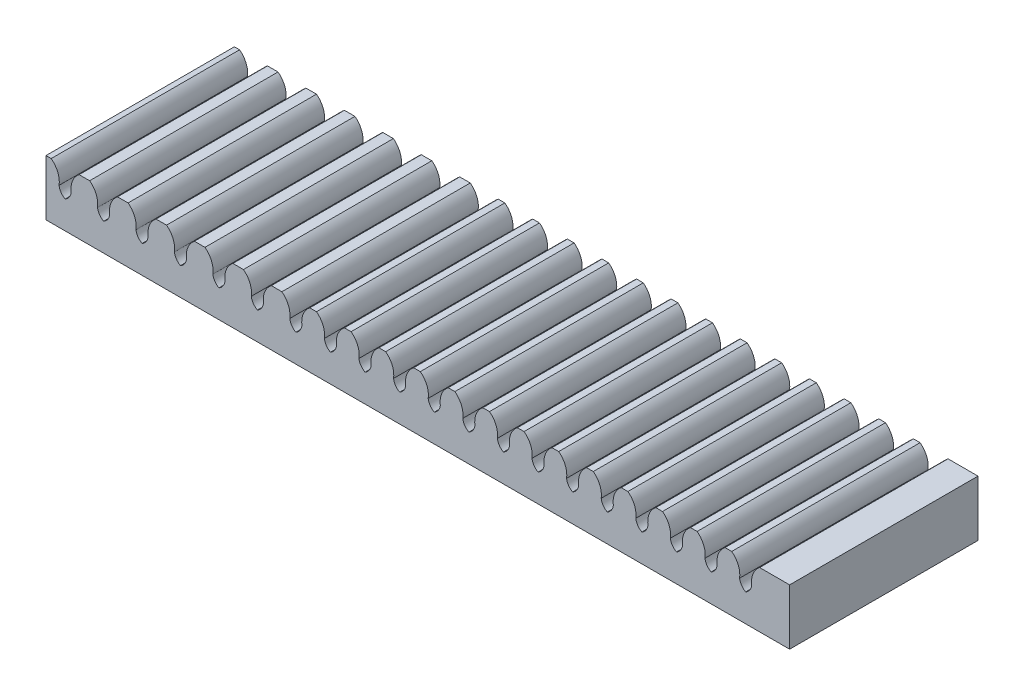
from build123d import *

# Parameters (mm, degrees)
BOSS_EXTRUDE1_DEPTH = 24.5
CUT_EXTRUDE1_DEPTH  = 26.12
LPATTERN1_COUNT     = 10
LPATTERN1_PITCH     = 5
LPATTERN1_COL_COUNT = 14
LPATTERN1_COL_PITCH = 4.5


with BuildPart() as part:
    # Sketch1 → Boss-Extrude1 (new body)
    with BuildSketch(Plane.XY):
        Polygon((28.000000003, 7), (-39.373173928, 7), (-39.373173928, -0.249149017), (0.939234275, -0.249149017), (57.333339072, -0.249149017), (57.333339072, 7), align=None)
    extrude(amount=BOSS_EXTRUDE1_DEPTH)

    # Sketch2 → Cut-Extrude1 (cut)
    with BuildSketch(Plane.XY):
        with BuildLine():
            ThreePointArc((-6.881285782, 3.348371163), (-7.417069895, 3.826658598), (-7.671285782, 4.498371163))
            ThreePointArc((-7.671285782, 4.498371163), (-7.912320341, 6.04482582), (-8.981285782, 7.188037328))
            ThreePointArc((-8.981285782, 7.188037328), (-6.881285782, 7.762283268), (-4.781285782, 7.188037328))
            ThreePointArc((-4.781285782, 7.188037328), (-5.850251222, 6.04482582), (-6.091285782, 4.498371163))
            ThreePointArc((-6.091285782, 4.498371163), (-6.345501668, 3.826658598), (-6.881285782, 3.348371163))
        make_face()
    cut_extrude1 = extrude(amount=CUT_EXTRUDE1_DEPTH, mode=Mode.SUBTRACT)

    # LPattern1: Cut-Extrude1 ×10
    with Locations(*[(-i * LPATTERN1_PITCH, 0, 0) for i in range(1, LPATTERN1_COUNT)]):
        add(cut_extrude1, mode=Mode.SUBTRACT)

    # LPattern1 col: Cut-Extrude1 ×14
    with Locations(*[(i * LPATTERN1_COL_PITCH, 0, 0) for i in range(1, LPATTERN1_COL_COUNT)]):
        add(cut_extrude1, mode=Mode.SUBTRACT)


solid = part.part
